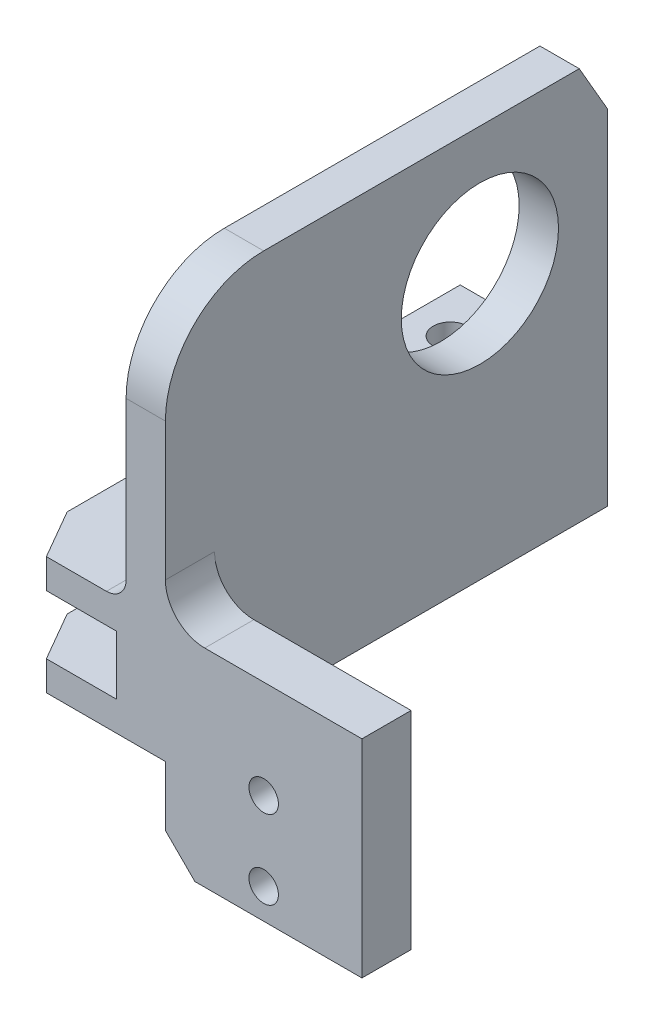
from build123d import *

# Parameters (mm, degrees)
ESTRUSIONE_ESTRUSIONE1_DEPTH = 45
SCHIZZO2_W                   = 5
SCHIZZO2_H                   = 21.077960569
ESTRUSIONE_ESTRUSIONE2_DEPTH = 20
SCHIZZO3_W                   = 4
SCHIZZO3_H                   = 45
ESTRUSIONE_ESTRUSIONE3_DEPTH = 28
SCHIZZO4_R                   = 8
TAGLIO_ESTRUSIONE1_DEPTH     = 28
SMUSSO1_SIZE                 = 5
SMUSSO1_SIZE2                = 2.886751346
SCHIZZO5_R                   = 1.75
TAGLIO_ESTRUSIONE2_DEPTH     = 28
RACCORDO1_R                  = 2
SMUSSO3_SIZE                 = 5
SMUSSO3_SIZE2                = 2.886751346
SMUSSO4_SIZE                 = 5
SMUSSO4_SIZE2                = 2.886751346
SCHIZZO7_R                   = 1.5
TAGLIO_ESTRUSIONE3_DEPTH     = 28
SMUSSO5_SIZE                 = 3
RACCORDO3_R                  = 4
RACCORDO4_R                  = 10


with BuildPart() as part:
    # Schizzo1 → Estrusione-Estrusione1 (new body)
    with BuildSketch(Plane.XY):
        Polygon((0, 0), (10, 0), (10, -6), (0, -6), (0, -9), (15, -9), (15, 3), (0, 3), align=None)
    extrude(amount=ESTRUSIONE_ESTRUSIONE1_DEPTH)

    # Schizzo2 → Estrusione-Estrusione2 (add)
    with BuildSketch(Plane(origin=(15, 0, 0), x_dir=(0, 0, -1), z_dir=(1, 0, 0))):
        with Locations((-42.5, -7.538980285)):
            Rectangle(SCHIZZO2_W, SCHIZZO2_H)
    extrude(amount=ESTRUSIONE_ESTRUSIONE2_DEPTH)

    # Schizzo3 → Estrusione-Estrusione3 (add)
    with BuildSketch(Plane(origin=(0, 3, 0), x_dir=(1, 0, 0), z_dir=(0, 1, 0))):
        with Locations((13, -22.5)):
            Rectangle(SCHIZZO3_W, SCHIZZO3_H)
    extrude(amount=ESTRUSIONE_ESTRUSIONE3_DEPTH)

    # Schizzo4 → Taglio-Estrusione1 (cut)
    with BuildSketch(Plane.ZY.offset(-11)):
        with Locations((13, 18)):
            Circle(SCHIZZO4_R)
    extrude(amount=-TAGLIO_ESTRUSIONE1_DEPTH, mode=Mode.SUBTRACT)

    # Smusso1
    smusso1_edges = [part.edges().sort_by_distance(p)[0] for p in [
        (13, 31, 0),
    ]]
    smusso1_side = [part.faces().sort_by_distance(p)[0] for p in [
        (5, 0.427200187, 0),
    ]]
    chamfer(smusso1_edges, length=SMUSSO1_SIZE, length2=SMUSSO1_SIZE2, reference=smusso1_side[0])

    # Schizzo5 → Taglio-Estrusione2 (cut)
    with BuildSketch(Plane(origin=(0, 3, 0), x_dir=(1, 0, 0), z_dir=(0, 1, 0))):
        with Locations((4, -5)):
            Circle(SCHIZZO5_R)
        with Locations((4, -25)):
            Circle(SCHIZZO5_R)
    extrude(amount=-TAGLIO_ESTRUSIONE2_DEPTH, mode=Mode.SUBTRACT)

    # Raccordo1
    raccordo1_edges = [part.edges().sort_by_distance(p)[0] for p in [
        (11, 3, 22.5),
    ]]
    fillet(raccordo1_edges, radius=RACCORDO1_R)

    # Smusso3
    smusso3_edges = [part.edges().sort_by_distance(p)[0] for p in [
        (0, 1.5, 45),
    ]]
    smusso3_side = [part.faces().sort_by_distance(p)[0] for p in [
        (0, 1.5, 22.5),
    ]]
    chamfer(smusso3_edges, length=SMUSSO3_SIZE, length2=SMUSSO3_SIZE2, reference=smusso3_side[0])

    # Smusso4
    smusso4_edges = [part.edges().sort_by_distance(p)[0] for p in [
        (0, -7.5, 45),
    ]]
    smusso4_side = [part.faces().sort_by_distance(p)[0] for p in [
        (0, -7.5, 22.5),
    ]]
    chamfer(smusso4_edges, length=SMUSSO4_SIZE, length2=SMUSSO4_SIZE2, reference=smusso4_side[0])

    # Schizzo7 → Taglio-Estrusione3 (cut)
    with BuildSketch(Plane.XY.offset(45)):
        with Locations((25, -7)):
            Circle(SCHIZZO7_R)
        with Locations((25, -15)):
            Circle(SCHIZZO7_R)
    extrude(amount=-TAGLIO_ESTRUSIONE3_DEPTH, mode=Mode.SUBTRACT)

    # Smusso5
    smusso5_edges = [part.edges().sort_by_distance(p)[0] for p in [
        (15, -18.077960569, 42.5),
    ]]
    chamfer(smusso5_edges, length=SMUSSO5_SIZE)

    # Raccordo3
    raccordo3_edges = [part.edges().sort_by_distance(p)[0] for p in [
        (15, 3, 42.5),
    ]]
    fillet(raccordo3_edges, radius=RACCORDO3_R)

    # Raccordo4
    raccordo4_edges = [part.edges().sort_by_distance(p)[0] for p in [
        (13, 31, 45),
    ]]
    fillet(raccordo4_edges, radius=RACCORDO4_R)


solid = part.part
